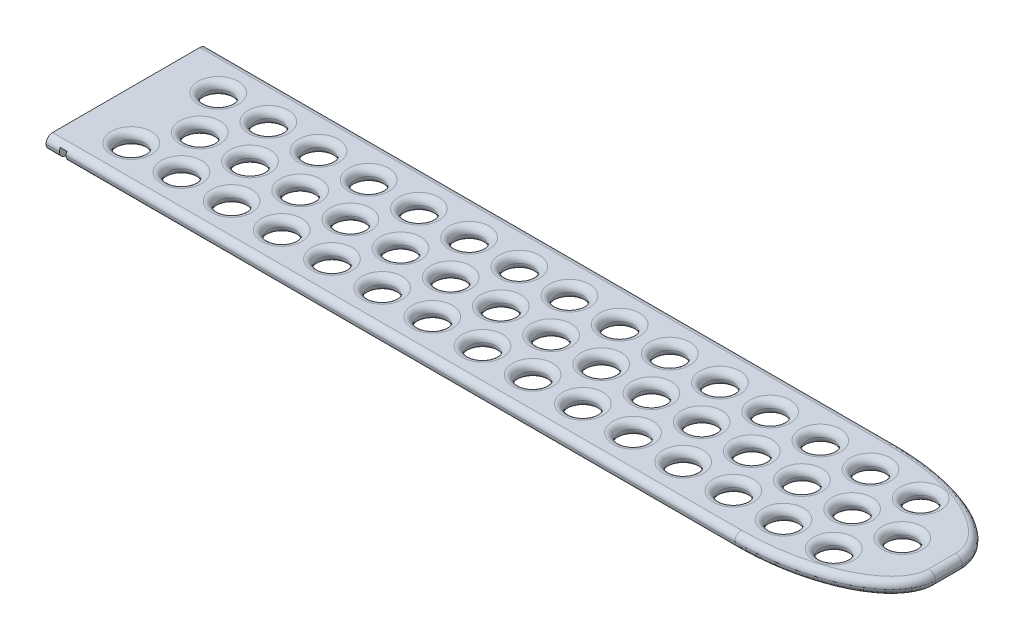
from build123d import *

# Parameters (mm, degrees)
SKETCH1_W               = 124
SKETCH1_H               = 24
BOSS_EXTRUDE1_DEPTH     = 2
FILLET1_SIZE            = 10
FILLET1_SIZE_2          = 20
FILLET2_SIZE            = 20
FILLET2_SIZE_2          = 10
SKETCH4_R               = 2
CUT_EXTRUDE2_DEPTH      = 148.229892638
FILLET3_R               = 1
CUT_EXTRUDE6_DEPTH      = 148.229892638
CUT_EXTRUDE6_DEPTH_BACK = 148.229892638
SKETCH11_W              = 1
SKETCH11_H              = 24
SKETCH12_W              = 1
SKETCH12_H              = 24
CUT_EXTRUDE7_DEPTH      = 1.5


# Some blends are built 0.0001 mm under size
with BuildPart() as part:
    # Sketch1 → Boss-Extrude1 (new body)
    with BuildSketch(Plane(origin=(0, 0, 0), x_dir=(1, 0, 0), z_dir=(0, 1, 0))):
        with Locations((84.726416348, 0)):
            Rectangle(SKETCH1_W, SKETCH1_H)
    extrude(amount=BOSS_EXTRUDE1_DEPTH)

    # Fillet1
    # an asymmetric fillet: 20, 10 mm, written as the material it takes off along each edge
    with BuildSketch(Plane(origin=(146.726416348, -50, 12), x_dir=(0, 0, -1), z_dir=(0, 1, 0))) as fillet1_piece_1:
        with BuildLine():
            Bezier((FILLET1_SIZE, 0), (0, 0), (0, FILLET1_SIZE_2), weights=[1, 0.707106781, 1])
            Line((0, FILLET1_SIZE_2), (0, 0))
            Line((0, 0), (FILLET1_SIZE, 0))
        make_face()
    extrude(amount=102, mode=Mode.SUBTRACT)

    # Fillet2
    # an asymmetric fillet: 20, 10 mm, written as the material it takes off along each edge
    with BuildSketch(Plane(origin=(146.726416348, -50, -12), x_dir=(-1, 0, 0), z_dir=(0, 1, 0))) as fillet2_piece_1:
        with BuildLine():
            Bezier((FILLET2_SIZE, 0), (0, 0), (0, FILLET2_SIZE_2), weights=[1, 0.707106781, 1])
            Line((0, FILLET2_SIZE_2), (0, 0))
            Line((0, 0), (FILLET2_SIZE, 0))
        make_face()
    extrude(amount=102, mode=Mode.SUBTRACT)

    # Sketch4 → Cut-Extrude2 (cut, through all)
    with BuildSketch(Plane(origin=(0, 2, 0), x_dir=(1, 0, 0), z_dir=(0, 1, 0))):
        with Locations(Location((30.973639598, 6.5, 0), (0, 0, 270))):
            Circle(SKETCH4_R)
        with Locations(Location((34.726416348, 0, 0), (0, 0, 270))):
            Circle(SKETCH4_R)
        with Locations(Location((30.973639598, -6.5, 0), (0, 0, 270))):
            Circle(SKETCH4_R)
        with Locations(Location((42.229193097, 0, 0), (0, 0, 270))):
            Circle(SKETCH4_R)
        with Locations(Location((38.476416348, 6.5, 0), (0, 0, 270))):
            Circle(SKETCH4_R)
        with Locations(Location((38.476416348, -6.5, 0), (0, 0, 270))):
            Circle(SKETCH4_R)
        with Locations(Location((49.731969847, 0, 0), (0, 0, 270))):
            Circle(SKETCH4_R)
        with Locations(Location((45.979193097, 6.5, 0), (0, 0, 270))):
            Circle(SKETCH4_R)
        with Locations(Location((45.979193097, -6.5, 0), (0, 0, 270))):
            Circle(SKETCH4_R)
        with Locations(Location((57.234746597, 0, 0), (0, 0, 270))):
            Circle(SKETCH4_R)
        with Locations(Location((53.481969847, 6.5, 0), (0, 0, 270))):
            Circle(SKETCH4_R)
        with Locations(Location((53.481969847, -6.5, 0), (0, 0, 270))):
            Circle(SKETCH4_R)
        with Locations(Location((64.737523346, 0, 0), (0, 0, 270))):
            Circle(SKETCH4_R)
        with Locations(Location((60.984746597, 6.5, 0), (0, 0, 270))):
            Circle(SKETCH4_R)
        with Locations(Location((60.984746597, -6.5, 0), (0, 0, 270))):
            Circle(SKETCH4_R)
        with Locations(Location((72.240300096, 0, 0), (0, 0, 270))):
            Circle(SKETCH4_R)
        with Locations(Location((68.487523346, 6.5, 0), (0, 0, 270))):
            Circle(SKETCH4_R)
        with Locations(Location((68.487523346, -6.5, 0), (0, 0, 270))):
            Circle(SKETCH4_R)
        with Locations(Location((79.743076846, 0, 0), (0, 0, 270))):
            Circle(SKETCH4_R)
        with Locations(Location((75.990300096, 6.5, 0), (0, 0, 270))):
            Circle(SKETCH4_R)
        with Locations(Location((75.990300096, -6.5, 0), (0, 0, 270))):
            Circle(SKETCH4_R)
        with Locations(Location((87.245853596, 0, 0), (0, 0, 270))):
            Circle(SKETCH4_R)
        with Locations(Location((83.493076846, 6.5, 0), (0, 0, 270))):
            Circle(SKETCH4_R)
        with Locations(Location((83.493076846, -6.5, 0), (0, 0, 270))):
            Circle(SKETCH4_R)
        with Locations(Location((94.748630345, 0, 0), (0, 0, 270))):
            Circle(SKETCH4_R)
        with Locations(Location((90.995853596, 6.5, 0), (0, 0, 270))):
            Circle(SKETCH4_R)
        with Locations(Location((90.995853596, -6.5, 0), (0, 0, 270))):
            Circle(SKETCH4_R)
        with Locations(Location((102.251407095, 0, 0), (0, 0, 270))):
            Circle(SKETCH4_R)
        with Locations(Location((98.498630345, 6.5, 0), (0, 0, 270))):
            Circle(SKETCH4_R)
        with Locations(Location((98.498630345, -6.5, 0), (0, 0, 270))):
            Circle(SKETCH4_R)
        with Locations(Location((109.754183845, 0, 0), (0, 0, 270))):
            Circle(SKETCH4_R)
        with Locations(Location((106.001407095, 6.5, 0), (0, 0, 270))):
            Circle(SKETCH4_R)
        with Locations(Location((106.001407095, -6.5, 0), (0, 0, 270))):
            Circle(SKETCH4_R)
        with Locations(Location((117.256960595, 0, 0), (0, 0, 270))):
            Circle(SKETCH4_R)
        with Locations(Location((113.504183845, 6.5, 0), (0, 0, 270))):
            Circle(SKETCH4_R)
        with Locations(Location((113.504183845, -6.5, 0), (0, 0, 270))):
            Circle(SKETCH4_R)
        with Locations(Location((124.759737344, 0, 0), (0, 0, 270))):
            Circle(SKETCH4_R)
        with Locations(Location((121.006960595, 6.5, 0), (0, 0, 270))):
            Circle(SKETCH4_R)
        with Locations(Location((121.006960595, -6.5, 0), (0, 0, 270))):
            Circle(SKETCH4_R)
        with Locations(Location((132.262514094, 0, 0), (0, 0, 270))):
            Circle(SKETCH4_R)
        with Locations(Location((128.509737344, 6.5, 0), (0, 0, 270))):
            Circle(SKETCH4_R)
        with Locations(Location((128.509737344, -6.5, 0), (0, 0, 270))):
            Circle(SKETCH4_R)
        with Locations(Location((139.765290844, 0, 0), (0, 0, 270))):
            Circle(SKETCH4_R)
        with Locations(Location((136.012514094, 6.5, 0), (0, 0, 270))):
            Circle(SKETCH4_R)
        with Locations(Location((136.012514094, -6.5, 0), (0, 0, 270))):
            Circle(SKETCH4_R)
    extrude(amount=-CUT_EXTRUDE2_DEPTH, mode=Mode.SUBTRACT)

    # Fillet3
    fillet3_edges = [part.edges().sort_by_distance(p)[0] for p in [
        (74.726416348, 0, 12),
        (136.012514094, 0, 4.5),
        (146.726416348, 0, 0),
        (136.012514094, 0, -8.5),
        (74.726416348, 0, -12),
        (30.973639598, 0, -8.5),
        (113.504183845, 0, 4.5),
        (117.256960595, 0, -2),
        (113.504183845, 0, -8.5),
        (60.984746597, 0, -8.5),
        (53.481969847, 0, 4.5),
        (57.234746597, 0, -2),
        (53.481969847, 0, -8.5),
        (72.240300096, 0, -2),
        (68.487523346, 0, -8.5),
        (60.984746597, 0, 4.5),
        (64.737523346, 0, -2),
        (42.229193097, 0, -2),
        (38.476416348, 0, -8.5),
        (30.973639598, 0, 4.5),
        (34.726416348, 0, -2),
        (45.979193097, 0, 4.5),
        (49.731969847, 0, -2),
        (45.979193097, 0, -8.5),
        (38.476416348, 0, 4.5),
        (102.251407095, 0, -2),
        (98.498630345, 0, -8.5),
        (90.995853596, 0, 4.5),
        (94.748630345, 0, -2),
        (106.001407095, 0, 4.5),
        (109.754183845, 0, -2),
        (106.001407095, 0, -8.5),
        (98.498630345, 0, 4.5),
        (75.990300096, 0, 4.5),
        (79.743076846, 0, -2),
        (75.990300096, 0, -8.5),
        (68.487523346, 0, 4.5),
        (90.995853596, 0, -8.5),
        (83.493076846, 0, 4.5),
        (87.245853596, 0, -2),
        (83.493076846, 0, -8.5),
        (136.012514094, 2, 4.5),
        (74.726416348, 2, 12),
        (74.726416348, 2, -12),
        (136.012514094, 2, -8.5),
        (146.726416348, 2, 0),
        (30.973639598, 2, -8.5),
        (113.504183845, 2, 4.5),
        (117.256960595, 2, -2),
        (113.504183845, 2, -8.5),
        (60.984746597, 2, -8.5),
        (53.481969847, 2, 4.5),
        (57.234746597, 2, -2),
        (53.481969847, 2, -8.5),
        (72.240300096, 2, -2),
        (68.487523346, 2, -8.5),
        (60.984746597, 2, 4.5),
        (64.737523346, 2, -2),
        (42.229193097, 2, -2),
        (38.476416348, 2, -8.5),
        (30.973639598, 2, 4.5),
        (34.726416348, 2, -2),
        (45.979193097, 2, 4.5),
        (49.731969847, 2, -2),
        (45.979193097, 2, -8.5),
        (38.476416348, 2, 4.5),
        (102.251407095, 2, -2),
        (98.498630345, 2, -8.5),
        (90.995853596, 2, 4.5),
        (94.748630345, 2, -2),
        (106.001407095, 2, 4.5),
        (109.754183845, 2, -2),
        (106.001407095, 2, -8.5),
        (98.498630345, 2, 4.5),
        (75.990300096, 2, 4.5),
        (79.743076846, 2, -2),
        (75.990300096, 2, -8.5),
        (68.487523346, 2, 4.5),
        (90.995853596, 2, -8.5),
        (83.493076846, 2, 4.5),
        (87.245853596, 2, -2),
        (83.493076846, 2, -8.5),
        (124.759737344, 0, -2),
        (121.006960595, 0, 4.5),
        (128.509737344, 0, -8.5),
        (132.262514094, 0, -2),
        (121.006960595, 0, -8.5),
        (139.765290844, 0, -2),
        (128.509737344, 0, 4.5),
        (124.759737344, 2, -2),
        (121.006960595, 2, 4.5),
        (128.509737344, 2, -8.5),
        (132.262514094, 2, -2),
        (121.006960595, 2, -8.5),
        (139.765290844, 2, -2),
        (128.509737344, 2, 4.5),
        (22.726416348, 0, 0),
        (22.726416348, 2, 0),
    ]]
    fillet(fillet3_edges, radius=FILLET3_R - 0.0001)  # a hair under: the kernel refuses the full size

    # Sketch11 → Cut-Extrude6 (cut, two sides: drawn at the far end of the back side and taken through both)
    with BuildSketch(Plane(origin=(0, 2, 0), x_dir=(1, 0, 0), z_dir=(0, 1, 0)).offset(-CUT_EXTRUDE6_DEPTH_BACK)):
        with Locations((23.226416348, 0)):
            Rectangle(SKETCH11_W, SKETCH11_H)
    extrude(amount=CUT_EXTRUDE6_DEPTH + CUT_EXTRUDE6_DEPTH_BACK, mode=Mode.SUBTRACT)

    # Sketch12 → Cut-Extrude7 (cut)
    with BuildSketch(Plane.XZ):
        with Locations((26.226416348, 0)):
            Rectangle(SKETCH12_W, SKETCH12_H)
    extrude(amount=-CUT_EXTRUDE7_DEPTH, mode=Mode.SUBTRACT)


solid = part.part
